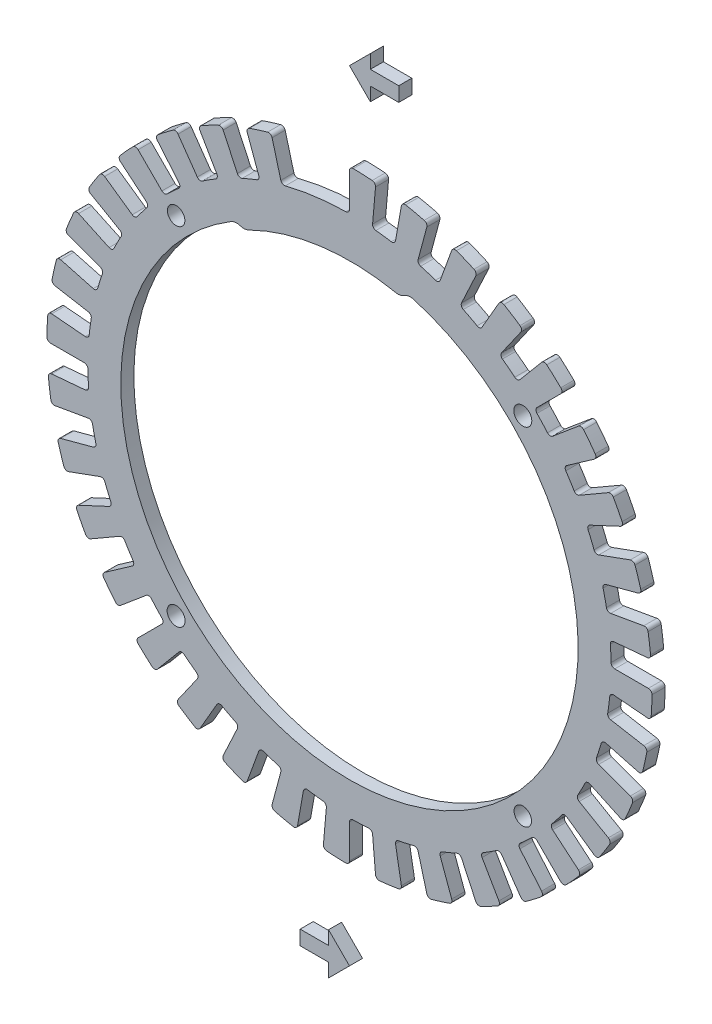
from build123d import *

# Parameters (mm, degrees)
SKETCH1_R             = 2.4585
SKETCH1_R_2           = 2.38125
BOSS_EXTRUDE1_DEPTH   = 3.571875
BOSS_EXTRUDE1_2_DEPTH = 3.571875
BOSS_EXTRUDE1_3_DEPTH = 3.571875


with BuildPart() as part:
    # Sketch1 → Boss-Extrude1 (new body)
    with BuildSketch(Plane.XY):
        with BuildLine():
            Line((7.120090774, 81.383009943), (6.318190247, 72.217244977))
            ThreePointArc((6.318190247, 72.217244977), (6.543925597, 71.492600102), (7.213496876, 71.135191451))
            ThreePointArc((7.213496876, 71.135191451), (9.332622744, 70.888307588), (11.443439394, 70.578308954))
            ThreePointArc((11.443439394, 70.578308954), (12.182699751, 70.750241401), (12.58829525, 71.391769993))
            Line((12.58829525, 71.391769993), (14.185993357, 80.45276622))
            ThreePointArc((14.185993357, 80.45276622), (14.60224868, 81.101765071), (15.35649023, 81.261726586))
            ThreePointArc((15.35649023, 81.261726586), (17.899556073, 80.739679789), (20.424982959, 80.138068801))
            ThreePointArc((20.424982959, 80.138068801), (21.040955292, 79.674338181), (21.143931966, 78.910228368))
            Line((21.143931966, 78.910228368), (18.762595726, 70.022960532))
            ThreePointArc((18.762595726, 70.022960532), (18.859068387, 69.270126109), (19.456404014, 68.801877466))
            ThreePointArc((19.456404014, 68.801877466), (21.500464665, 68.190761978), (23.525382569, 67.518933456))
            ThreePointArc((23.525382569, 67.518933456), (24.283267656, 67.559882649), (24.794101519, 68.12123406))
            Line((24.794101519, 68.12123406), (27.940952485, 76.76713603))
            ThreePointArc((27.940952485, 76.76713603), (28.463581422, 77.333993152), (29.234141374, 77.360551822))
            ThreePointArc((29.234141374, 77.360551822), (31.647919857, 76.404837339), (34.030511182, 75.373830397))
            ThreePointArc((34.030511182, 75.373830397), (34.556599534, 74.810182414), (34.525325484, 74.039799434))
            Line((34.525325484, 74.039799434), (30.636909229, 65.701063864))
            ThreePointArc((30.636909229, 65.701063864), (30.601187928, 64.942914386), (31.108138161, 64.378053249))
            ThreePointArc((31.108138161, 64.378053249), (33.015025846, 63.421274572), (34.892518899, 62.40802933))
            ThreePointArc((34.892518899, 62.40802933), (35.646000762, 62.316751049), (36.24655156, 62.780868901))
            Line((36.24655156, 62.780868901), (40.84693991, 70.748975258))
            ThreePointArc((40.84693991, 70.748975258), (41.460062645, 71.216466984), (42.223527925, 71.108815836))
            ThreePointArc((42.223527925, 71.108815836), (44.43467761, 69.748472569), (46.602039543, 68.319396297))
            ThreePointArc((46.602039543, 68.319396297), (47.022258986, 67.67295711), (46.857684459, 66.91970866))
            Line((46.857684459, 66.91970866), (41.580335748, 59.382873618))
            ThreePointArc((41.580335748, 59.382873618), (41.413505858, 58.642445073), (41.814667271, 57.998134462))
            ThreePointArc((41.814667271, 57.998134462), (43.526442174, 56.724763831), (45.199463699, 55.400888814))
            ThreePointArc((45.199463699, 55.400888814), (45.925648172, 55.180156502), (46.597668473, 55.53293881))
            Line((46.597668473, 55.53293881), (52.511813735, 62.581142673))
            ThreePointArc((52.511813735, 62.581142673), (53.196800845, 62.935064503), (53.929973946, 62.696474464))
            ThreePointArc((53.929973946, 62.696474464), (55.87131017, 60.972835754), (57.757588515, 59.189111912))
            ThreePointArc((57.757588515, 59.189111912), (58.059170893, 58.479523249), (57.766296402, 57.766296402))
            Line((57.766296402, 57.766296402), (51.260364806, 51.260364806))
            ThreePointArc((51.260364806, 51.260364806), (50.967495369, 50.56015474), (51.250678875, 49.855971707))
            ThreePointArc((51.250678875, 49.855971707), (52.715329582, 48.304699845), (54.133045666, 46.710420325))
            ThreePointArc((54.133045666, 46.710420325), (54.809868002, 46.366940822), (55.53293881, 46.597668473))
            Line((55.53293881, 46.597668473), (62.581142673, 52.511813735))
            ThreePointArc((62.581142673, 52.511813735), (63.31718117, 52.741411935), (63.997784998, 52.379132441))
            ThreePointArc((63.997784998, 52.379132441), (65.610321242, 50.344570179), (67.158202386, 48.260396313))
            ThreePointArc((67.158202386, 48.260396313), (67.331984272, 47.509218665), (66.91970866, 46.857684459))
            Line((66.91970866, 46.857684459), (59.382873618, 41.580335748))
            ThreePointArc((59.382873618, 41.580335748), (58.972863325, 40.94161969), (59.129464536, 40.19896048))
            ThreePointArc((59.129464536, 40.19896048), (60.302488376, 38.416921997), (61.421822434, 36.600679351))
            ThreePointArc((61.421822434, 36.600679351), (62.028717727, 36.144889108), (62.780868901, 36.24655156))
            Line((62.780868901, 36.24655156), (70.748975258, 40.84693991))
            ThreePointArc((70.748975258, 40.84693991), (71.513700985, 40.945238253), (72.121055738, 40.470276985))
            ThreePointArc((72.121055738, 40.470276985), (73.355795904, 38.186610315), (74.518248261, 35.865312993))
            ThreePointArc((74.518248261, 35.865312993), (74.55894938, 35.095370514), (74.039799434, 34.525325484))
            Line((74.039799434, 34.525325484), (65.701063864, 30.636909229))
            ThreePointArc((65.701063864, 30.636909229), (65.186370669, 30.079094244), (65.211631338, 29.320524181))
            ThreePointArc((65.211631338, 29.320524181), (66.057386575, 27.361865414), (66.844328207, 25.378845255))
            ThreePointArc((66.844328207, 25.378845255), (67.362856253, 24.824593229), (68.12123406, 24.794101519))
            Line((68.12123406, 24.794101519), (76.76713603, 27.940952485))
            ThreePointArc((76.76713603, 27.940952485), (77.537313183, 27.904964226), (78.052964694, 27.331752641))
            ThreePointArc((78.052964694, 27.331752641), (78.872391827, 24.868369619), (79.614094871, 22.380480286))
            ThreePointArc((79.614094871, 22.380480286), (79.52047854, 21.615167288), (78.910228368, 21.143931966))
            Line((78.910228368, 21.143931966), (70.022960532, 18.762595726))
            ThreePointArc((70.022960532, 18.762595726), (69.419223127, 18.30263074), (69.312375721, 17.551198591))
            ThreePointArc((69.312375721, 17.551198591), (69.805164509, 15.475432397), (70.235802893, 13.385887789))
            ThreePointArc((70.235802893, 13.385887789), (70.650208479, 12.750014647), (71.391769993, 12.58829525))
            Line((71.391769993, 12.58829525), (80.45276622, 14.185993357))
            ThreePointArc((80.45276622, 14.185993357), (81.204993357, 14.016811982), (81.613273815, 13.362766823))
            ThreePointArc((81.613273815, 13.362766823), (81.992490036, 10.794516097), (82.290907495, 8.215628011))
            ThreePointArc((82.290907495, 8.215628011), (82.065818199, 7.478198142), (81.383009943, 7.120090774))
            Line((81.383009943, 7.120090774), (72.217244977, 6.318190247))
            ThreePointArc((72.217244977, 6.318190247), (71.542807618, 5.970051062), (71.30709864, 5.248588713))
            ThreePointArc((71.30709864, 5.248588713), (71.431947843, 3.118786197), (71.49319825, 0.986206897))
            ThreePointArc((71.49319825, 0.986206897), (71.79088987, 0.288033321), (72.49310312, 0))
            Line((72.49310312, 0), (81.69387982, 0))
            ThreePointArc((81.69387982, 0), (82.405300898, -0.297234001), (82.693804909, -1.012239902))
            ThreePointArc((82.693804909, -1.012239902), (82.621287925, -3.607323335), (82.467352536, -6.198851964))
            ThreePointArc((82.467352536, -6.198851964), (82.1176295, -6.88599227), (81.383009943, -7.120090774))
            Line((81.383009943, -7.120090774), (72.217244977, -6.318190247))
            ThreePointArc((72.217244977, -6.318190247), (71.492600102, -6.543925597), (71.135191451, -7.213496876))
            ThreePointArc((71.135191451, -7.213496876), (70.888307588, -9.332622744), (70.578308954, -11.443439394))
            ThreePointArc((70.578308954, -11.443439394), (70.750241401, -12.182699751), (71.391769993, -12.58829525))
            Line((71.391769993, -12.58829525), (80.45276622, -14.185993357))
            ThreePointArc((80.45276622, -14.185993357), (81.101765071, -14.60224868), (81.261726586, -15.35649023))
            ThreePointArc((81.261726586, -15.35649023), (80.739679789, -17.899556073), (80.138068801, -20.424982959))
            ThreePointArc((80.138068801, -20.424982959), (79.674338181, -21.040955292), (78.910228368, -21.143931966))
            Line((78.910228368, -21.143931966), (70.022960532, -18.762595726))
            ThreePointArc((70.022960532, -18.762595726), (69.270126109, -18.859068387), (68.801877466, -19.456404014))
            ThreePointArc((68.801877466, -19.456404014), (68.190761979, -21.500464665), (67.518933456, -23.525382569))
            ThreePointArc((67.518933456, -23.525382569), (67.559882649, -24.283267656), (68.12123406, -24.794101519))
            Line((68.12123406, -24.794101519), (76.76713603, -27.940952485))
            ThreePointArc((76.76713603, -27.940952485), (77.333993152, -28.463581422), (77.360551822, -29.234141374))
            ThreePointArc((77.360551822, -29.234141374), (76.404837339, -31.647919857), (75.373830397, -34.030511182))
            ThreePointArc((75.373830397, -34.030511182), (74.810182414, -34.556599534), (74.039799434, -34.525325484))
            Line((74.039799434, -34.525325484), (65.701063864, -30.636909229))
            ThreePointArc((65.701063864, -30.636909229), (64.942914386, -30.601187928), (64.378053249, -31.10813816))
            ThreePointArc((64.378053249, -31.10813816), (63.421274572, -33.015025846), (62.40802933, -34.892518899))
            ThreePointArc((62.40802933, -34.892518899), (62.316751049, -35.646000762), (62.780868901, -36.24655156))
            Line((62.780868901, -36.24655156), (70.748975258, -40.84693991))
            ThreePointArc((70.748975258, -40.84693991), (71.216466984, -41.460062645), (71.108815836, -42.223527925))
            ThreePointArc((71.108815836, -42.223527925), (69.748472569, -44.43467761), (68.319396297, -46.602039543))
            ThreePointArc((68.319396297, -46.602039543), (67.67295711, -47.022258986), (66.91970866, -46.857684459))
            Line((66.91970866, -46.857684459), (59.382873618, -41.580335748))
            ThreePointArc((59.382873618, -41.580335748), (58.642445073, -41.413505858), (57.998134462, -41.814667271))
            ThreePointArc((57.998134462, -41.814667271), (56.724763831, -43.526442174), (55.400888814, -45.199463699))
            ThreePointArc((55.400888814, -45.199463699), (55.180156502, -45.925648172), (55.53293881, -46.597668473))
            Line((55.53293881, -46.597668473), (62.581142673, -52.511813735))
            ThreePointArc((62.581142673, -52.511813735), (62.935064503, -53.196800845), (62.696474464, -53.929973946))
            ThreePointArc((62.696474464, -53.929973946), (60.972835754, -55.87131017), (59.189111912, -57.757588515))
            ThreePointArc((59.189111912, -57.757588515), (58.479523249, -58.059170893), (57.766296402, -57.766296402))
            Line((57.766296402, -57.766296402), (51.260364806, -51.260364806))
            ThreePointArc((51.260364806, -51.260364806), (50.56015474, -50.967495369), (49.855971707, -51.250678875))
            ThreePointArc((49.855971707, -51.250678875), (48.304699845, -52.715329582), (46.710420325, -54.133045666))
            ThreePointArc((46.710420325, -54.133045666), (46.366940822, -54.809868002), (46.597668473, -55.53293881))
            Line((46.597668473, -55.53293881), (52.511813735, -62.581142673))
            ThreePointArc((52.511813735, -62.581142673), (52.741411935, -63.31718117), (52.379132441, -63.997784998))
            ThreePointArc((52.379132441, -63.997784998), (50.344570179, -65.610321242), (48.260396313, -67.158202386))
            ThreePointArc((48.260396313, -67.158202386), (47.509218665, -67.331984272), (46.857684459, -66.91970866))
            Line((46.857684459, -66.91970866), (41.580335748, -59.382873618))
            ThreePointArc((41.580335748, -59.382873618), (40.94161969, -58.972863325), (40.19896048, -59.129464536))
            ThreePointArc((40.19896048, -59.129464536), (38.416921997, -60.302488376), (36.600679351, -61.421822434))
            ThreePointArc((36.600679351, -61.421822434), (36.144889108, -62.028717727), (36.24655156, -62.780868901))
            Line((36.24655156, -62.780868901), (40.84693991, -70.748975258))
            ThreePointArc((40.84693991, -70.748975258), (40.945238253, -71.513700985), (40.470276985, -72.121055738))
            ThreePointArc((40.470276985, -72.121055738), (38.186610315, -73.355795904), (35.865312993, -74.518248261))
            ThreePointArc((35.865312993, -74.518248261), (35.095370514, -74.55894938), (34.525325484, -74.039799434))
            Line((34.525325484, -74.039799434), (30.636909229, -65.701063864))
            ThreePointArc((30.636909229, -65.701063864), (30.079094244, -65.186370669), (29.320524181, -65.211631338))
            ThreePointArc((29.320524181, -65.211631338), (27.361865414, -66.057386575), (25.378845255, -66.844328207))
            ThreePointArc((25.378845255, -66.844328207), (24.824593229, -67.362856253), (24.794101519, -68.12123406))
            Line((24.794101519, -68.12123406), (27.940952485, -76.76713603))
            ThreePointArc((27.940952485, -76.76713603), (27.904964226, -77.537313183), (27.331752641, -78.052964694))
            ThreePointArc((27.331752641, -78.052964694), (24.868369619, -78.872391827), (22.380480286, -79.614094871))
            ThreePointArc((22.380480286, -79.614094871), (21.615167288, -79.52047854), (21.143931966, -78.910228368))
            Line((21.143931966, -78.910228368), (18.762595726, -70.022960532))
            ThreePointArc((18.762595726, -70.022960532), (18.30263074, -69.419223127), (17.551198591, -69.312375721))
            ThreePointArc((17.551198591, -69.312375721), (15.475432397, -69.805164509), (13.385887789, -70.235802893))
            ThreePointArc((13.385887789, -70.235802893), (12.750014647, -70.650208479), (12.58829525, -71.391769993))
            Line((12.58829525, -71.391769993), (14.185993357, -80.45276622))
            ThreePointArc((14.185993357, -80.45276622), (14.016811982, -81.204993357), (13.362766823, -81.613273815))
            ThreePointArc((13.362766823, -81.613273815), (10.794516097, -81.992490036), (8.215628011, -82.290907495))
            ThreePointArc((8.215628011, -82.290907495), (7.478198142, -82.065818199), (7.120090774, -81.383009943))
            Line((7.120090774, -81.383009943), (6.318190247, -72.217244977))
            ThreePointArc((6.318190247, -72.217244977), (5.970051062, -71.542807618), (5.248588713, -71.30709864))
            ThreePointArc((5.248588713, -71.30709864), (3.118786197, -71.431947843), (0.986206897, -71.49319825))
            ThreePointArc((0.986206897, -71.49319825), (0.288033321, -71.79088987), (0, -72.49310312))
            Line((0, -72.49310312), (0, -81.69387982))
            ThreePointArc((0, -81.69387982), (-0.297234001, -82.405300898), (-1.012239902, -82.693804909))
            ThreePointArc((-1.012239902, -82.693804909), (-3.607323335, -82.621287925), (-6.198851964, -82.467352536))
            ThreePointArc((-6.198851964, -82.467352536), (-6.88599227, -82.1176295), (-7.120090774, -81.383009943))
            Line((-7.120090774, -81.383009943), (-6.318190247, -72.217244977))
            ThreePointArc((-6.318190247, -72.217244977), (-6.543925597, -71.492600102), (-7.213496876, -71.135191451))
            ThreePointArc((-7.213496876, -71.135191451), (-9.332622744, -70.888307588), (-11.443439394, -70.578308954))
            ThreePointArc((-11.443439394, -70.578308954), (-12.182699751, -70.750241401), (-12.58829525, -71.391769993))
            Line((-12.58829525, -71.391769993), (-14.185993357, -80.45276622))
            ThreePointArc((-14.185993357, -80.45276622), (-14.60224868, -81.101765071), (-15.35649023, -81.261726586))
            ThreePointArc((-15.35649023, -81.261726586), (-17.899556073, -80.739679789), (-20.424982959, -80.138068801))
            ThreePointArc((-20.424982959, -80.138068801), (-21.040955292, -79.674338181), (-21.143931966, -78.910228368))
            Line((-21.143931966, -78.910228368), (-18.762595726, -70.022960532))
            ThreePointArc((-18.762595726, -70.022960532), (-18.859068387, -69.270126109), (-19.456404014, -68.801877466))
            ThreePointArc((-19.456404014, -68.801877466), (-21.500464665, -68.190761979), (-23.525382569, -67.518933456))
            ThreePointArc((-23.525382569, -67.518933456), (-24.283267656, -67.559882649), (-24.794101519, -68.12123406))
            Line((-24.794101519, -68.12123406), (-27.940952485, -76.76713603))
            ThreePointArc((-27.940952485, -76.76713603), (-28.463581422, -77.333993152), (-29.234141374, -77.360551822))
            ThreePointArc((-29.234141374, -77.360551822), (-31.647919857, -76.404837339), (-34.030511182, -75.373830397))
            ThreePointArc((-34.030511182, -75.373830397), (-34.556599534, -74.810182414), (-34.525325484, -74.039799434))
            Line((-34.525325484, -74.039799434), (-30.636909229, -65.701063864))
            ThreePointArc((-30.636909229, -65.701063864), (-30.601187928, -64.942914386), (-31.10813816, -64.378053249))
            ThreePointArc((-31.10813816, -64.378053249), (-33.015025846, -63.421274572), (-34.892518899, -62.40802933))
            ThreePointArc((-34.892518899, -62.40802933), (-35.646000762, -62.316751049), (-36.24655156, -62.780868901))
            Line((-36.24655156, -62.780868901), (-40.84693991, -70.748975258))
            ThreePointArc((-40.84693991, -70.748975258), (-41.460062645, -71.216466984), (-42.223527925, -71.108815836))
            ThreePointArc((-42.223527925, -71.108815836), (-44.43467761, -69.748472569), (-46.602039543, -68.319396297))
            ThreePointArc((-46.602039543, -68.319396297), (-47.022258986, -67.67295711), (-46.857684459, -66.91970866))
            Line((-46.857684459, -66.91970866), (-41.580335748, -59.382873618))
            ThreePointArc((-41.580335748, -59.382873618), (-41.413505858, -58.642445073), (-41.814667271, -57.998134462))
            ThreePointArc((-41.814667271, -57.998134462), (-43.526442174, -56.724763831), (-45.199463699, -55.400888814))
            ThreePointArc((-45.199463699, -55.400888814), (-45.925648172, -55.180156502), (-46.597668473, -55.53293881))
            Line((-46.597668473, -55.53293881), (-52.511813735, -62.581142673))
            ThreePointArc((-52.511813735, -62.581142673), (-53.196800845, -62.935064504), (-53.929973946, -62.696474464))
            ThreePointArc((-53.929973946, -62.696474464), (-55.87131017, -60.972835754), (-57.757588515, -59.189111912))
            ThreePointArc((-57.757588515, -59.189111912), (-58.059170893, -58.479523249), (-57.766296402, -57.766296402))
            Line((-57.766296402, -57.766296402), (-51.260364806, -51.260364806))
            ThreePointArc((-51.260364806, -51.260364806), (-50.967495369, -50.56015474), (-51.250678875, -49.855971707))
            ThreePointArc((-51.250678875, -49.855971707), (-52.715329582, -48.304699845), (-54.133045666, -46.710420325))
            ThreePointArc((-54.133045666, -46.710420325), (-54.809868002, -46.366940822), (-55.53293881, -46.597668473))
            Line((-55.53293881, -46.597668473), (-62.581142673, -52.511813735))
            ThreePointArc((-62.581142673, -52.511813735), (-63.31718117, -52.741411935), (-63.997784998, -52.379132441))
            ThreePointArc((-63.997784998, -52.379132441), (-65.610321242, -50.344570179), (-67.158202386, -48.260396313))
            ThreePointArc((-67.158202386, -48.260396313), (-67.331984272, -47.509218665), (-66.91970866, -46.857684459))
            Line((-66.91970866, -46.857684459), (-59.382873618, -41.580335748))
            ThreePointArc((-59.382873618, -41.580335748), (-58.972863325, -40.94161969), (-59.129464536, -40.19896048))
            ThreePointArc((-59.129464536, -40.19896048), (-60.302488376, -38.416921997), (-61.421822434, -36.600679351))
            ThreePointArc((-61.421822434, -36.600679351), (-62.028717727, -36.144889108), (-62.780868901, -36.24655156))
            Line((-62.780868901, -36.24655156), (-70.748975258, -40.84693991))
            ThreePointArc((-70.748975258, -40.84693991), (-71.513700985, -40.945238253), (-72.121055738, -40.470276985))
            ThreePointArc((-72.121055738, -40.470276985), (-73.355795904, -38.186610315), (-74.518248261, -35.865312993))
            ThreePointArc((-74.518248261, -35.865312993), (-74.55894938, -35.095370514), (-74.039799434, -34.525325484))
            Line((-74.039799434, -34.525325484), (-65.701063864, -30.636909229))
            ThreePointArc((-65.701063864, -30.636909229), (-65.186370669, -30.079094244), (-65.211631338, -29.320524181))
            ThreePointArc((-65.211631338, -29.320524181), (-66.057386575, -27.361865414), (-66.844328207, -25.378845255))
            ThreePointArc((-66.844328207, -25.378845255), (-67.362856253, -24.824593229), (-68.12123406, -24.794101519))
            Line((-68.12123406, -24.794101519), (-76.76713603, -27.940952485))
            ThreePointArc((-76.76713603, -27.940952485), (-77.537313183, -27.904964226), (-78.052964694, -27.331752641))
            ThreePointArc((-78.052964694, -27.331752641), (-78.872391827, -24.868369619), (-79.614094871, -22.380480286))
            ThreePointArc((-79.614094871, -22.380480286), (-79.52047854, -21.615167288), (-78.910228368, -21.143931966))
            Line((-78.910228368, -21.143931966), (-70.022960532, -18.762595726))
            ThreePointArc((-70.022960532, -18.762595726), (-69.419223127, -18.30263074), (-69.312375721, -17.551198591))
            ThreePointArc((-69.312375721, -17.551198591), (-69.805164509, -15.475432397), (-70.235802893, -13.385887789))
            ThreePointArc((-70.235802893, -13.385887789), (-70.650208479, -12.750014647), (-71.391769993, -12.58829525))
            Line((-71.391769993, -12.58829525), (-80.45276622, -14.185993357))
            ThreePointArc((-80.45276622, -14.185993357), (-81.204993357, -14.016811982), (-81.613273815, -13.362766823))
            ThreePointArc((-81.613273815, -13.362766823), (-81.992490036, -10.794516097), (-82.290907495, -8.215628011))
            ThreePointArc((-82.290907495, -8.215628011), (-82.065818199, -7.478198142), (-81.383009943, -7.120090774))
            Line((-81.383009943, -7.120090774), (-72.217244977, -6.318190247))
            ThreePointArc((-72.217244977, -6.318190247), (-71.542807618, -5.970051062), (-71.30709864, -5.248588713))
            ThreePointArc((-71.30709864, -5.248588713), (-71.431947843, -3.118786197), (-71.49319825, -0.986206897))
            ThreePointArc((-71.49319825, -0.986206897), (-71.79088987, -0.288033321), (-72.49310312, 0))
            Line((-72.49310312, 0), (-81.69387982, 0))
            ThreePointArc((-81.69387982, 0), (-82.405300898, 0.297234001), (-82.693804909, 1.012239902))
            ThreePointArc((-82.693804909, 1.012239902), (-82.621287925, 3.607323335), (-82.467352536, 6.198851964))
            ThreePointArc((-82.467352536, 6.198851964), (-82.1176295, 6.88599227), (-81.383009943, 7.120090774))
            Line((-81.383009943, 7.120090774), (-72.217244977, 6.318190247))
            ThreePointArc((-72.217244977, 6.318190247), (-71.492600102, 6.543925597), (-71.135191451, 7.213496876))
            ThreePointArc((-71.135191451, 7.213496876), (-70.888307588, 9.332622744), (-70.578308954, 11.443439394))
            ThreePointArc((-70.578308954, 11.443439394), (-70.750241401, 12.182699751), (-71.391769993, 12.58829525))
            Line((-71.391769993, 12.58829525), (-80.45276622, 14.185993357))
            ThreePointArc((-80.45276622, 14.185993357), (-81.101765071, 14.60224868), (-81.261726586, 15.35649023))
            ThreePointArc((-81.261726586, 15.35649023), (-80.739679789, 17.899556073), (-80.138068801, 20.424982959))
            ThreePointArc((-80.138068801, 20.424982959), (-79.674338181, 21.040955292), (-78.910228368, 21.143931966))
            Line((-78.910228368, 21.143931966), (-70.022960532, 18.762595726))
            ThreePointArc((-70.022960532, 18.762595726), (-69.270126109, 18.859068387), (-68.801877466, 19.456404014))
            ThreePointArc((-68.801877466, 19.456404014), (-68.190761979, 21.500464665), (-67.518933456, 23.525382569))
            ThreePointArc((-67.518933456, 23.525382569), (-67.559882649, 24.283267656), (-68.12123406, 24.794101519))
            Line((-68.12123406, 24.794101519), (-76.76713603, 27.940952485))
            ThreePointArc((-76.76713603, 27.940952485), (-77.333993152, 28.463581422), (-77.360551822, 29.234141374))
            ThreePointArc((-77.360551822, 29.234141374), (-76.404837339, 31.647919857), (-75.373830397, 34.030511182))
            ThreePointArc((-75.373830397, 34.030511182), (-74.810182414, 34.556599534), (-74.039799434, 34.525325484))
            Line((-74.039799434, 34.525325484), (-65.701063864, 30.636909229))
            ThreePointArc((-65.701063864, 30.636909229), (-64.942914386, 30.601187928), (-64.378053249, 31.10813816))
            ThreePointArc((-64.378053249, 31.10813816), (-63.421274572, 33.015025846), (-62.40802933, 34.892518899))
            ThreePointArc((-62.40802933, 34.892518899), (-62.316751049, 35.646000762), (-62.780868901, 36.24655156))
            Line((-62.780868901, 36.24655156), (-70.748975258, 40.84693991))
            ThreePointArc((-70.748975258, 40.84693991), (-71.216466984, 41.460062645), (-71.108815836, 42.223527925))
            ThreePointArc((-71.108815836, 42.223527925), (-69.748472569, 44.43467761), (-68.319396297, 46.602039543))
            ThreePointArc((-68.319396297, 46.602039543), (-67.67295711, 47.022258986), (-66.91970866, 46.857684459))
            Line((-66.91970866, 46.857684459), (-59.382873618, 41.580335748))
            ThreePointArc((-59.382873618, 41.580335748), (-58.642445073, 41.413505858), (-57.998134462, 41.814667271))
            ThreePointArc((-57.998134462, 41.814667271), (-56.724763831, 43.526442174), (-55.400888814, 45.199463699))
            ThreePointArc((-55.400888814, 45.199463699), (-55.180156502, 45.925648172), (-55.53293881, 46.597668473))
            Line((-55.53293881, 46.597668473), (-62.581142673, 52.511813735))
            ThreePointArc((-62.581142673, 52.511813735), (-62.935064504, 53.196800845), (-62.696474464, 53.929973946))
            ThreePointArc((-62.696474464, 53.929973946), (-60.972835754, 55.87131017), (-59.189111912, 57.757588515))
            ThreePointArc((-59.189111912, 57.757588515), (-58.479523249, 58.059170893), (-57.766296402, 57.766296402))
            Line((-57.766296402, 57.766296402), (-51.260364806, 51.260364806))
            ThreePointArc((-51.260364806, 51.260364806), (-50.56015474, 50.967495369), (-49.855971707, 51.250678875))
            ThreePointArc((-49.855971707, 51.250678875), (-48.304699845, 52.715329582), (-46.710420325, 54.133045666))
            ThreePointArc((-46.710420325, 54.133045666), (-46.366940822, 54.809868002), (-46.597668473, 55.53293881))
            Line((-46.597668473, 55.53293881), (-52.511813735, 62.581142673))
            ThreePointArc((-52.511813735, 62.581142673), (-52.741411935, 63.31718117), (-52.379132441, 63.997784998))
            ThreePointArc((-52.379132441, 63.997784998), (-50.344570179, 65.610321242), (-48.260396313, 67.158202386))
            ThreePointArc((-48.260396313, 67.158202386), (-47.509218665, 67.331984272), (-46.857684459, 66.91970866))
            Line((-46.857684459, 66.91970866), (-41.580335748, 59.382873618))
            ThreePointArc((-41.580335748, 59.382873618), (-40.94161969, 58.972863325), (-40.19896048, 59.129464536))
            ThreePointArc((-40.19896048, 59.129464536), (-38.416921997, 60.302488376), (-36.600679351, 61.421822434))
            ThreePointArc((-36.600679351, 61.421822434), (-36.144889108, 62.028717727), (-36.24655156, 62.780868901))
            Line((-36.24655156, 62.780868901), (-40.84693991, 70.748975258))
            ThreePointArc((-40.84693991, 70.748975258), (-40.945238253, 71.513700985), (-40.470276985, 72.121055738))
            ThreePointArc((-40.470276985, 72.121055738), (-38.186610315, 73.355795904), (-35.865312993, 74.518248261))
            ThreePointArc((-35.865312993, 74.518248261), (-35.095370514, 74.55894938), (-34.525325484, 74.039799434))
            Line((-34.525325484, 74.039799434), (-30.636909229, 65.701063864))
            ThreePointArc((-30.636909229, 65.701063864), (-30.079094244, 65.186370669), (-29.320524181, 65.211631338))
            ThreePointArc((-29.320524181, 65.211631338), (-27.361865414, 66.057386575), (-25.378845255, 66.844328207))
            ThreePointArc((-25.378845255, 66.844328207), (-24.824593229, 67.362856253), (-24.794101519, 68.12123406))
            Line((-24.794101519, 68.12123406), (-27.940952485, 76.76713603))
            ThreePointArc((-27.940952485, 76.76713603), (-27.904964226, 77.537313183), (-27.331752641, 78.052964694))
            ThreePointArc((-27.331752641, 78.052964694), (-24.868369619, 78.872391827), (-22.380480286, 79.614094871))
            ThreePointArc((-22.380480286, 79.614094871), (-21.615167288, 79.52047854), (-21.143931966, 78.910228368))
            Line((-21.143931966, 78.910228368), (-18.762595726, 70.022960532))
            ThreePointArc((-18.762595726, 70.022960532), (-18.30263074, 69.419223127), (-17.551198591, 69.312375721))
            ThreePointArc((-17.551198591, 69.312375721), (-15.475432397, 69.805164509), (-13.385887789, 70.235802893))
            ThreePointArc((-13.385887789, 70.235802893), (-7.213573177, 71.135183714), (-0.986360266, 71.493196134))
            ThreePointArc((-0.986360266, 71.493196134), (-0.288033321, 71.79088987), (0, 72.49310312))
            Line((0, 72.49310312), (0, 81.69387982))
            ThreePointArc((0, 81.69387982), (0.297234001, 82.405300898), (1.012239902, 82.693804909))
            ThreePointArc((1.012239902, 82.693804909), (3.607323335, 82.621287925), (6.198851964, 82.467352536))
            ThreePointArc((6.198851964, 82.467352536), (6.88599227, 82.1176295), (7.120090774, 81.383009943))
        make_face()
        with Locations((47.376154339, 47.376154339)):
            Circle(SKETCH1_R, mode=Mode.SUBTRACT)
        with Locations((-47.376154339, -47.376154339)):
            Circle(SKETCH1_R, mode=Mode.SUBTRACT)
        with Locations((47.376154339, -47.376154339)):
            Circle(SKETCH1_R_2, mode=Mode.SUBTRACT)
        with Locations((-47.376154339, 47.376154339)):
            Circle(SKETCH1_R_2, mode=Mode.SUBTRACT)
        with BuildLine():
            ThreePointArc((-32.399534916, 53.446423053), (8.157887014, -61.965303836), (17.462595357, 60.010897039))
            ThreePointArc((17.462595357, 60.010897039), (16.158723626, 60.09401264), (14.943172899, 59.61502817))
            ThreePointArc((14.943172899, 59.61502817), (13.835125402, 59.154945408), (12.635405963, 59.165839098))
            ThreePointArc((12.635405963, 59.165839098), (-7.879614623, 59.851615177), (-27.518110923, 53.879528313))
            ThreePointArc((-27.518110923, 53.879528313), (-28.674131419, 53.558495577), (-29.863501295, 53.716117604))
            ThreePointArc((-29.863501295, 53.716117604), (-31.161603438, 53.864173396), (-32.399534916, 53.446423053))
        make_face(mode=Mode.SUBTRACT)
    extrude(amount=BOSS_EXTRUDE1_DEPTH)


with BuildPart() as body_2:
    # Sketch1 → Boss-Extrude1 2 (new body)
    with BuildSketch(Plane.XY):
        Polygon((0, 106.553638396), (5.714510199, 112.268148596), (5.714510199, 108.532615757), (13.471241193, 108.532615757), (13.471241193, 104.574661035), (5.714510199, 104.574661035), (5.714510199, 100.839128197), align=None)
    extrude(amount=BOSS_EXTRUDE1_2_DEPTH)


with BuildPart() as body_3:
    # Sketch1 → Boss-Extrude1 3 (new body)
    with BuildSketch(Plane.XY):
        Polygon((0, -106.553638396), (-5.714510199, -112.268148596), (-5.714510199, -108.532615757), (-13.471241193, -108.532615757), (-13.471241193, -104.574661035), (-5.714510199, -104.574661035), (-5.714510199, -100.839128197), align=None)
    extrude(amount=BOSS_EXTRUDE1_3_DEPTH)


solid = Compound([part.part, body_2.part, body_3.part])
